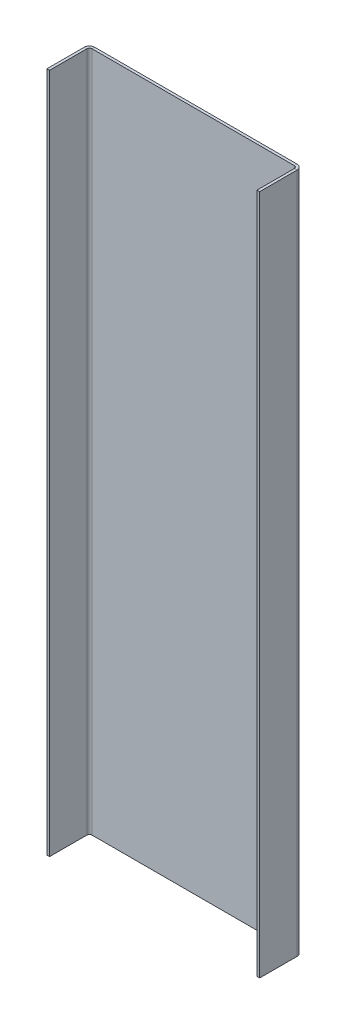
from build123d import *

# Parameters (mm, degrees)
SKETCH1_W                      = 127
SKETCH1_H                      = 406.4
BOSS_EXTRUDE1_DEPTH            = 1.5875
EDGE_FLANGE1_STRIP_W           = 9.525
EDGE_FLANGE1_STRIP_H           = 1.5875
EDGE_FLANGE1_STRIP_CUT_DEPTH   = 406.4
EDGE_FLANGE1_STRIP_2_W         = 9.525
EDGE_FLANGE1_STRIP_2_H         = 1.5875
EDGE_FLANGE1_STRIP_CUT_2_DEPTH = 406.4
EDGE_FLANGE1_DEPTH             = 406.4
EDGE_FLANGE1_BEND_DEPTH        = 406.4


# Sheet-metal steps are written as plain solids
with BuildPart() as part:
    # Sketch1 → Boss-Extrude1 (new body)
    with BuildSketch(Plane.XY):
        with Locations((63.5, 203.2)):
            Rectangle(SKETCH1_W, SKETCH1_H)
    extrude(amount=BOSS_EXTRUDE1_DEPTH)

    # Edge-Flange1 strip (across the edge) → Edge-Flange1 strip cut (cut)
    with BuildSketch(Plane(origin=(127, 0, 1.5875), x_dir=(-1, 0, 0), z_dir=(0, 1, 0))):
        with Locations((-1.5875, -0.79375)):
            Rectangle(EDGE_FLANGE1_STRIP_W, EDGE_FLANGE1_STRIP_H)
    extrude(amount=EDGE_FLANGE1_STRIP_CUT_DEPTH, mode=Mode.SUBTRACT)

    # Edge-Flange1 strip 2 (across the edge) → Edge-Flange1 strip cut 2 (cut)
    with BuildSketch(Plane(origin=(0, 406.4, 1.5875), x_dir=(1, 0, 0), z_dir=(0, -1, 0))):
        with Locations((-1.5875, -0.79375)):
            Rectangle(EDGE_FLANGE1_STRIP_2_W, EDGE_FLANGE1_STRIP_2_H)
    extrude(amount=EDGE_FLANGE1_STRIP_CUT_2_DEPTH, mode=Mode.SUBTRACT)

    # Edge-Flange1 section (across the edge) → Edge-Flange1 (add)
    with BuildSketch(Plane(origin=(127, 0, 1.5875), x_dir=(-1, 0, 0), z_dir=(0, 1, 0))):
        with BuildLine():
            Line((0, 1.5875), (0, 23.8125))
            Line((0, 23.8125), (1.5875, 23.8125))
            Line((1.5875, 23.8125), (1.5875, 1.5875))
            ThreePointArc((1.5875, 1.5875), (2.052467985, 0.464967985), (3.175, 0))
            Line((3.175, 0), (3.175, -1.5875))
            ThreePointArc((3.175, -1.5875), (0.92993597, -0.65756403), (0, 1.5875))
        make_face()
    extrude(amount=EDGE_FLANGE1_DEPTH)

    # Edge-Flange1 section 2 (across the edge) → Edge-Flange1 bend (add)
    with BuildSketch(Plane(origin=(0, 406.4, 1.5875), x_dir=(1, 0, 0), z_dir=(0, -1, 0))):
        with BuildLine():
            Line((0, 1.5875), (0, 23.8125))
            Line((0, 23.8125), (1.5875, 23.8125))
            Line((1.5875, 23.8125), (1.5875, 1.5875))
            ThreePointArc((1.5875, 1.5875), (2.052467985, 0.464967985), (3.175, 0))
            Line((3.175, 0), (3.175, -1.5875))
            ThreePointArc((3.175, -1.5875), (0.92993597, -0.65756403), (0, 1.5875))
        make_face()
    extrude(amount=EDGE_FLANGE1_BEND_DEPTH)


solid = part.part
